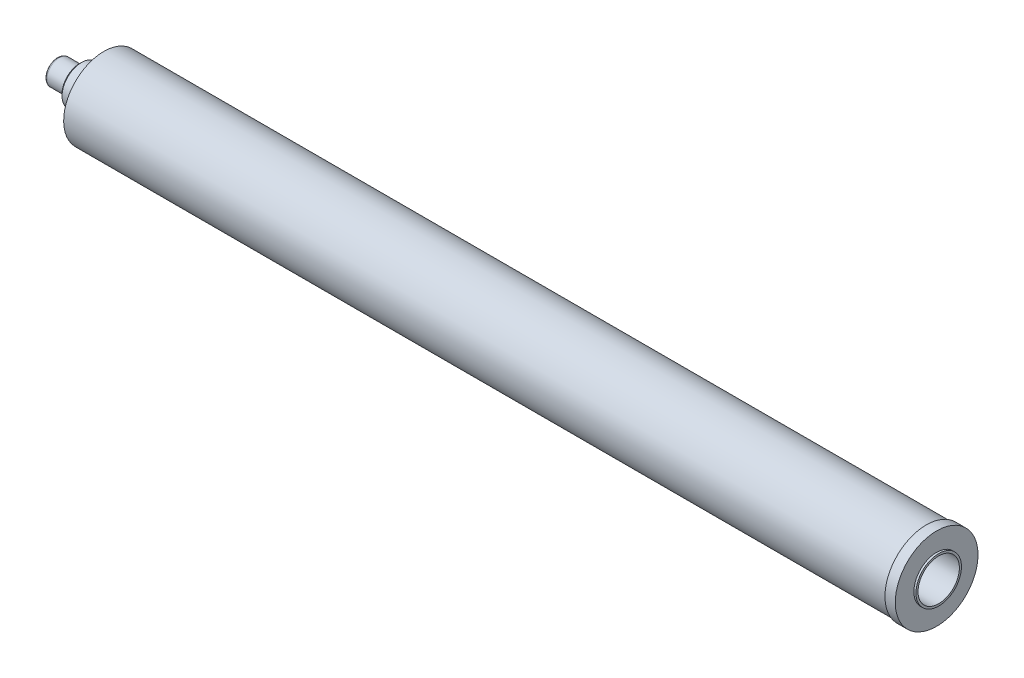
from build123d import *

# Parameters (mm, degrees)
CSK_FOR_3_8_FLAT_HEAD_MACHINE_SCREW_100_D           = 10.0838
CSK_FOR_3_8_FLAT_HEAD_MACHINE_SCREW_100_DEPTH       = 25.4
CSK_FOR_3_8_FLAT_HEAD_MACHINE_SCREW_100_CSINK_D     = 19.3548
CSK_FOR_3_8_FLAT_HEAD_MACHINE_SCREW_100_CSINK_ANGLE = 100
CSK_FOR_3_8_FLAT_HEAD_MACHINE_SCREW_100_TIP         = 3.029479155
FILLET1_R                                           = 2.54
CHAMFER1_SIZE                                       = 2.54
SKETCH4_R                                           = 27.94
SKETCH4_R_2                                         = 25.4
BOSS_EXTRUDE1_DEPTH                                 = 2.54
CUT_EXTRUDE1_START                                  = -508
SKETCH5_R                                           = 25.4
CUT_EXTRUDE1_DEPTH                                  = 508


with BuildPart() as part:
    # Sketch1 → Revolve1 (revolve)
    with BuildSketch(Plane.XY):
        Polygon((0, 0), (0, 15.24), (27.305, 15.24), (27.305, 23.876), (57.15, 23.876), (57.15, 49.2125), (1067.054, 49.2125), (1067.054, 50.8), (1079.754, 50.8), (1079.754, 0), align=None)
    revolve(axis=Axis((1079.754, 0, 0), (-1, 0, 0)))

    # CSK for 3/8 Flat Head Machine Screw (100)1
    with Locations(Plane.ZY):
        with Locations((0, 0)):
            CounterSinkHole(CSK_FOR_3_8_FLAT_HEAD_MACHINE_SCREW_100_D / 2, CSK_FOR_3_8_FLAT_HEAD_MACHINE_SCREW_100_CSINK_D / 2, depth=CSK_FOR_3_8_FLAT_HEAD_MACHINE_SCREW_100_DEPTH, counter_sink_angle=CSK_FOR_3_8_FLAT_HEAD_MACHINE_SCREW_100_CSINK_ANGLE)
            with Locations((0, 0, -(CSK_FOR_3_8_FLAT_HEAD_MACHINE_SCREW_100_DEPTH + CSK_FOR_3_8_FLAT_HEAD_MACHINE_SCREW_100_TIP / 2))):  # 118° drill point
                Cone(0, CSK_FOR_3_8_FLAT_HEAD_MACHINE_SCREW_100_D / 2, CSK_FOR_3_8_FLAT_HEAD_MACHINE_SCREW_100_TIP, mode=Mode.SUBTRACT)

    # Fillet1
    fillet1_edges = [part.edges().sort_by_distance(p)[0] for p in [
        (0, -15.24, 0),
    ]]
    fillet(fillet1_edges, radius=FILLET1_R)

    # Chamfer1
    chamfer1_edges = [part.edges().sort_by_distance(p)[0] for p in [
        (27.305, -23.876, 0),
    ]]
    chamfer(chamfer1_edges, length=CHAMFER1_SIZE)

    # Sketch4 → Boss-Extrude1 (add)
    with BuildSketch(Plane(origin=(1079.754, 0, 0), x_dir=(0, 0, -1), z_dir=(1, 0, 0))):
        Circle(SKETCH4_R)
        Circle(SKETCH4_R_2, mode=Mode.SUBTRACT)
    extrude(amount=BOSS_EXTRUDE1_DEPTH)

    # Sketch5 → Cut-Extrude1 (cut)
    with BuildSketch(Plane(origin=(1082.294, 0, 0), x_dir=(0, 0, -1), z_dir=(1, 0, 0)).offset(CUT_EXTRUDE1_START)):
        Circle(SKETCH5_R)
    extrude(amount=CUT_EXTRUDE1_DEPTH, mode=Mode.SUBTRACT)


solid = part.part
